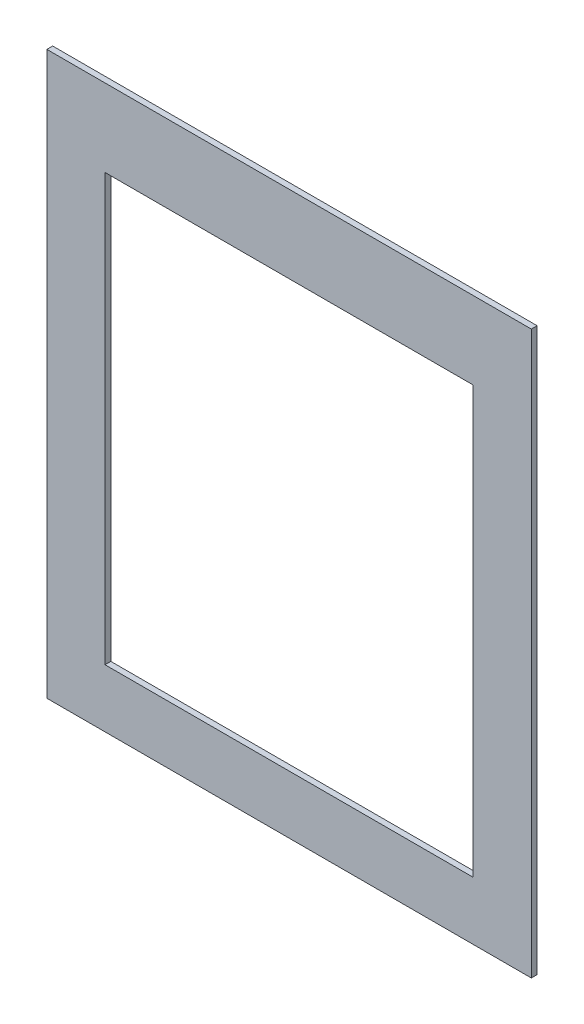
from build123d import *

# Parameters (mm, degrees)
SKETCH_1_W      = 500
SKETCH_1_H      = 580
SKETCH_1_W_2    = 380
SKETCH_1_H_2    = 440
EXTRUDE_1_DEPTH = 6


with BuildPart() as part:
    # Эскиз1 → Бобышка-Вытянуть1 (new body)
    with BuildSketch(Plane.XY):
        with Locations((192.327917168, 270.464227839)):
            Rectangle(SKETCH_1_W, SKETCH_1_H)
        with Locations((192.327917168, 260.464227839)):
            Rectangle(SKETCH_1_W_2, SKETCH_1_H_2, mode=Mode.SUBTRACT)
    extrude(amount=EXTRUDE_1_DEPTH)


solid = part.part
